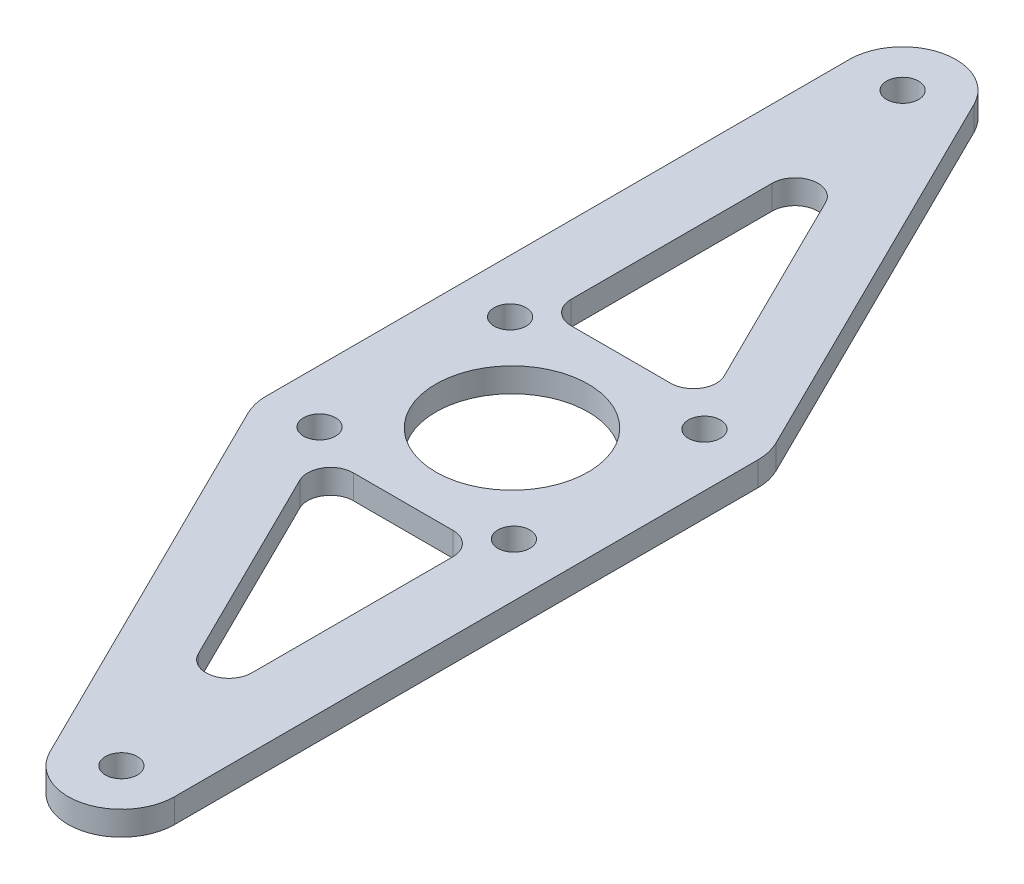
from build123d import *

# Parameters (mm, degrees)
SKETCH1_R           = 2.1
SKETCH1_R_2         = 10
BOSS_EXTRUDE1_DEPTH = 3.175


with BuildPart() as part:
    # Sketch1 → Boss-Extrude1 (new body)
    with BuildSketch(Plane(origin=(0, 0, 0), x_dir=(1, 0, 0), z_dir=(0, 1, 0))):
        with BuildLine():
            Line((6.476876236, -67.106109825), (-19.023123764, -15.606109825))
            ThreePointArc((-19.023123764, -15.606109825), (-19.565858946, -14.095013112), (-19.75, -12.5))
            Line((-19.75, -12.5), (-19.75, 64))
            ThreePointArc((-19.75, 64), (-14.345013112, 70.815858946), (-6.476876236, 67.106109825))
            Line((-6.476876236, 67.106109825), (19.023123764, 15.606109825))
            ThreePointArc((19.023123764, 15.606109825), (19.565858946, 14.095013112), (19.75, 12.5))
            Line((19.75, 12.5), (19.75, -64))
            ThreePointArc((19.75, -64), (14.345013112, -70.815858946), (6.476876236, -67.106109825))
        make_face()
        with Locations((-12.75, 64)):
            Circle(SKETCH1_R, mode=Mode.SUBTRACT)
        with Locations((-12.75, 12.5)):
            Circle(SKETCH1_R, mode=Mode.SUBTRACT)
        with Locations((12.75, 12.5)):
            Circle(SKETCH1_R, mode=Mode.SUBTRACT)
        with Locations((12.75, -12.5)):
            Circle(SKETCH1_R, mode=Mode.SUBTRACT)
        with Locations((12.75, -64)):
            Circle(SKETCH1_R, mode=Mode.SUBTRACT)
        with Locations((-12.75, -12.5)):
            Circle(SKETCH1_R, mode=Mode.SUBTRACT)
        Circle(SKETCH1_R_2, mode=Mode.SUBTRACT)
        with BuildLine():
            Line((-5.061518387, 46.218659407), (8.004121842, 19.831189925))
            ThreePointArc((8.004121842, 19.831189925), (7.864519372, 16.917844789), (5.315640229, 15.5))
            Line((5.315640229, 15.5), (-7.75, 15.5))
            ThreePointArc((-7.75, 15.5), (-9.871320344, 16.378679656), (-10.75, 18.5))
            Line((-10.75, 18.5), (-10.75, 44.887469482))
            ThreePointArc((-10.75, 44.887469482), (-8.433577048, 47.808551887), (-5.061518387, 46.218659407))
        make_face(mode=Mode.SUBTRACT)
        with BuildLine():
            Line((5.061518387, -46.218659407), (-8.004121842, -19.831189925))
            ThreePointArc((-8.004121842, -19.831189925), (-7.864519372, -16.917844789), (-5.315640229, -15.5))
            Line((-5.315640229, -15.5), (7.75, -15.5))
            ThreePointArc((7.75, -15.5), (9.871320344, -16.378679656), (10.75, -18.5))
            Line((10.75, -18.5), (10.75, -44.887469482))
            ThreePointArc((10.75, -44.887469482), (8.433577048, -47.808551887), (5.061518387, -46.218659407))
        make_face(mode=Mode.SUBTRACT)
    extrude(amount=-BOSS_EXTRUDE1_DEPTH)


solid = part.part
